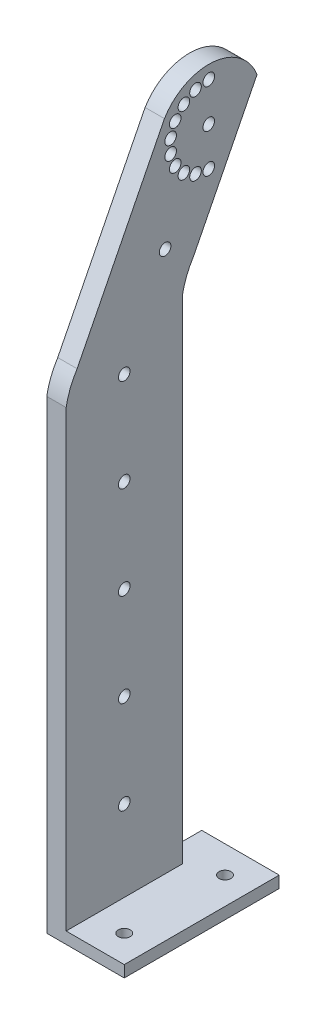
from build123d import *

# Parameters (mm, degrees)
SKETCH_1_R          = 1.5
EXTRUDE_2_DEPTH     = 5
CUT_EXTRUDE_2_DEPTH = 1
SKETCH_4_W          = 20
SKETCH_4_H          = 40
EXTRUDE_3_DEPTH     = 3
SKETCH_5_R          = 1.55
CUT_EXTRUDE_3_DEPTH = 10


with BuildPart() as part:
    # 草图1 → 凸台-拉伸2 (new body)
    with BuildSketch(Plane(origin=(0, 0, 0), x_dir=(0, 0, -1), z_dir=(1, 0, 0))):
        with BuildLine():
            Line((-15, 0), (15, 0))
            Line((15, 0), (15, 130))
            ThreePointArc((15, 130), (16.060667235, 133.763397528), (17.833287426, 137.248507798))
            Line((17.833287426, 137.248507798), (34.277601095, 169.80605943))
            ThreePointArc((34.277601095, 169.80605943), (22.969406924, 178.256928012), (10.37531975, 171.878730504))
            Line((10.37531975, 171.878730504), (-12.166712574, 127.248507798))
            ThreePointArc((-12.166712574, 127.248507798), (-13.939332765, 123.763397528), (-15, 120))
            Line((-15, 120), (-15, 0))
        make_face()
        with Locations((0, 23.934052351)):
            Circle(SKETCH_1_R, mode=Mode.SUBTRACT)
        with Locations((0, 47.934052351)):
            Circle(SKETCH_1_R, mode=Mode.SUBTRACT)
        with Locations((0, 71.934052351)):
            Circle(SKETCH_1_R, mode=Mode.SUBTRACT)
        with Locations((0, 95.934052351)):
            Circle(SKETCH_1_R, mode=Mode.SUBTRACT)
        with Locations((10.541707006, 142.602806473)):
            Circle(SKETCH_1_R, mode=Mode.SUBTRACT)
        with Locations((0, 119.934052351)):
            Circle(SKETCH_1_R, mode=Mode.SUBTRACT)
        with Locations((21.812723168, 164.917917825)):
            Circle(SKETCH_1_R, mode=Mode.SUBTRACT)
        with Locations((11.964645637, 166.654399602)):
            Circle(SKETCH_1_R, mode=Mode.SUBTRACT)
        with Locations((11.964645637, 163.181436049)):
            Circle(SKETCH_1_R, mode=Mode.SUBTRACT)
        with Locations((13.15246913, 159.917917825)):
            Circle(SKETCH_1_R, mode=Mode.SUBTRACT)
        with Locations((15.384847071, 157.257473394)):
            Circle(SKETCH_1_R, mode=Mode.SUBTRACT)
        with Locations((21.812723168, 154.917917825)):
            Circle(SKETCH_1_R, mode=Mode.SUBTRACT)
        with Locations((18.392521734, 155.520991617)):
            Circle(SKETCH_1_R, mode=Mode.SUBTRACT)
        with Locations((13.15246913, 169.917917825)):
            Circle(SKETCH_1_R, mode=Mode.SUBTRACT)
        with Locations((15.384847071, 172.578362256)):
            Circle(SKETCH_1_R, mode=Mode.SUBTRACT)
        with Locations((18.392521734, 174.314844033)):
            Circle(SKETCH_1_R, mode=Mode.SUBTRACT)
        with Locations((21.812723168, 174.917917825)):
            Circle(SKETCH_1_R, mode=Mode.SUBTRACT)
    extrude(amount=-EXTRUDE_2_DEPTH)

    # 草图3 → 切除-拉伸2 (cut)
    with BuildSketch(Plane.ZY.offset(5)):
        with BuildLine():
            Line((-10, 5), (10, 5))
            Line((10, 5), (10, 119.524724411))
            ThreePointArc((10, 119.524724411), (9.161705076, 122.242477333), (7.82549521, 124.753147068))
            Line((7.82549521, 124.753147068), (-14.73885303, 169.427552317))
            ThreePointArc((-14.73885303, 169.427552317), (-21.607154469, 173.304465594), (-28.657153069, 169.768713769))
            Line((-28.657153069, 169.768713769), (-13.477541954, 139.715104809))
            ThreePointArc((-13.477541954, 139.715104809), (-11.272736422, 135.241025308), (-10, 130.418298195))
            Line((-10, 130.418298195), (-10, 5))
        make_face()
    extrude(amount=-CUT_EXTRUDE_2_DEPTH, mode=Mode.SUBTRACT)

    # 草图4 → 凸台-拉伸3 (add)
    with BuildSketch(Plane(origin=(0, 0, 0), x_dir=(-1, 0, 0), z_dir=(0, -1, 0))):
        with Locations((-5, 5)):
            Rectangle(SKETCH_4_W, SKETCH_4_H)
    extrude(amount=-EXTRUDE_3_DEPTH)

    # 草图5 → 切除-拉伸3 (cut)
    with BuildSketch(Plane.XZ):
        with Locations((8, -18)):
            Circle(SKETCH_5_R)
        with Locations((8, 8)):
            Circle(SKETCH_5_R)
    extrude(amount=-CUT_EXTRUDE_3_DEPTH, mode=Mode.SUBTRACT)


solid = part.part
